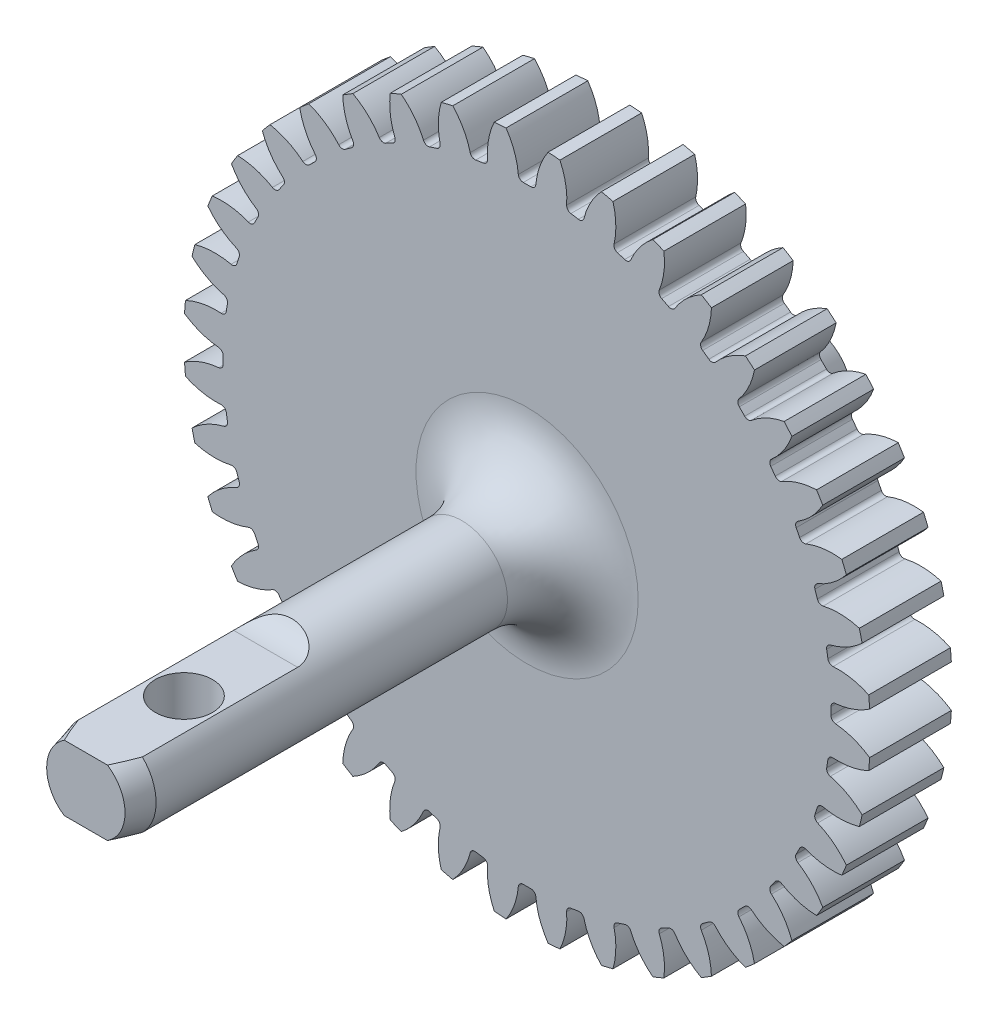
from build123d import *

# Parameters (mm, degrees)
SKETCH1_R                = 21
BOSS_EXTRUDE1_DEPTH      = 2.5
CUT_EXTRUDE1_DEPTH       = 31.116440693
FILLET1_R                = 0.3
CIRPATTERN1_COUNT        = 40
FILLET1_OF_CIRPATTERN1_R = 0.3
SKETCH4_R                = 2.8
BOSS_EXTRUDE2_DEPTH      = 27
BOSS_EXTRUDE3_START      = 12.43
SKETCH5_R                = 2.8
BOSS_EXTRUDE3_DEPTH      = 12.43
FILLET3_R                = 7.4
CHAMFER1_SIZE            = 1.5
CHAMFER1_SIZE2           = 0.401923789
FILLET4_R                = 4
CHAMFER2_SIZE            = 1.5
CHAMFER2_SIZE2           = 0.401923789
CUT_EXTRUDE2_START       = -13
CUT_EXTRUDE2_DEPTH       = 13
SKETCH7_R                = 1.75
CUT_EXTRUDE3_DEPTH       = 11
FILLET5_R                = 2


with BuildPart() as part:
    # Sketch1 → Boss-Extrude1 (new, symmetric)
    with BuildSketch(Plane.XY):
        Circle(SKETCH1_R)
    extrude(amount=BOSS_EXTRUDE1_DEPTH, both=True)

    # Sketch3 → Cut-Extrude1 (cut, symmetric)
    with BuildSketch(Plane.XY.offset(2.5)):
        with BuildLine():
            ThreePointArc((-2.139593078, 21.895710572), (-0.970695217, 20.420263648), (-0.519675362, 18.592738839))
            ThreePointArc((-0.519675362, 18.592738839), (0, 18.6), (0.519675362, 18.592738839))
            ThreePointArc((0.519675362, 18.592738839), (0.970695217, 20.420263648), (2.139593078, 21.895710572))
            ThreePointArc((2.139593078, 21.895710572), (0, 22), (-2.139593078, 21.895710572))
        make_face()
    cut_extrude1 = extrude(amount=CUT_EXTRUDE1_DEPTH, both=True, mode=Mode.SUBTRACT)

    # Fillet1
    fillet1_edges = [part.edges().sort_by_distance(p)[0] for p in [
        (-0.519675362, 18.592738839, 0),
        (0.519675362, 18.592738839, 0),
    ]]
    fillet(fillet1_edges, radius=FILLET1_R)

    # CirPattern1: Cut-Extrude1 ×40 about axis
    cirpattern1_axis = Axis((0, 0, 0), (0, 0, 1))
    for i in range(1, CIRPATTERN1_COUNT):
        add(cut_extrude1.rotate(cirpattern1_axis, i * 360 / CIRPATTERN1_COUNT), mode=Mode.SUBTRACT)

    # Fillet1 of CirPattern1
    fillet1_of_cirpattern1_edges = [part.edges().sort_by_distance(p)[0] for p in [
        (-3.42182245, 18.282536233, 0),
        (-2.395267858, 18.445126508, 0),
        (-6.239712913, 17.52215691, 0),
        (-5.251231633, 17.843333947, 0),
        (-8.903960935, 16.33032393, 0),
        (-7.977892658, 16.802179285, 0),
        (-11.348963889, 14.736384178, 0),
        (-10.508111489, 15.347299206, 0),
        (-13.514517686, 12.779585741, 0),
        (-12.779585741, 13.514517686, 0),
        (-15.347299206, 10.508111489, 0),
        (-14.736384178, 11.348963889, 0),
        (-16.802179285, 7.977892658, 0),
        (-16.33032393, 8.903960935, 0),
        (-17.843333947, 5.251231633, 0),
        (-17.52215691, 6.239712913, 0),
        (-18.445126508, 2.395267858, 0),
        (-18.282536233, 3.42182245, 0),
        (-18.592738839, -0.519675362, 0),
        (-18.592738839, 0.519675362, 0),
        (-18.282536233, -3.42182245, 0),
        (-18.445126508, -2.395267858, 0),
        (-17.52215691, -6.239712913, 0),
        (-17.843333947, -5.251231633, 0),
        (-16.33032393, -8.903960935, 0),
        (-16.802179285, -7.977892658, 0),
        (-14.736384178, -11.348963889, 0),
        (-15.347299206, -10.508111489, 0),
        (-12.779585741, -13.514517686, 0),
        (-13.514517686, -12.779585741, 0),
        (-10.508111489, -15.347299206, 0),
        (-11.348963889, -14.736384178, 0),
        (-7.977892658, -16.802179285, 0),
        (-8.903960935, -16.33032393, 0),
        (-5.251231633, -17.843333947, 0),
        (-6.239712913, -17.52215691, 0),
        (-2.395267858, -18.445126508, 0),
        (-3.42182245, -18.282536233, 0),
        (0.519675362, -18.592738839, 0),
        (-0.519675362, -18.592738839, 0),
        (3.42182245, -18.282536233, 0),
        (2.395267858, -18.445126508, 0),
        (6.239712913, -17.52215691, 0),
        (5.251231633, -17.843333947, 0),
        (8.903960935, -16.33032393, 0),
        (7.977892658, -16.802179285, 0),
        (11.348963889, -14.736384178, 0),
        (10.508111489, -15.347299206, 0),
        (13.514517686, -12.779585741, 0),
        (12.779585741, -13.514517686, 0),
        (15.347299206, -10.508111489, 0),
        (14.736384178, -11.348963889, 0),
        (16.802179285, -7.977892658, 0),
        (16.33032393, -8.903960935, 0),
        (17.843333947, -5.251231633, 0),
        (17.52215691, -6.239712913, 0),
        (18.445126508, -2.395267858, 0),
        (18.282536233, -3.42182245, 0),
        (18.592738839, 0.519675362, 0),
        (18.592738839, -0.519675362, 0),
        (18.282536233, 3.42182245, 0),
        (18.445126508, 2.395267858, 0),
        (17.52215691, 6.239712913, 0),
        (17.843333947, 5.251231633, 0),
        (16.33032393, 8.903960935, 0),
        (16.802179285, 7.977892658, 0),
        (14.736384178, 11.348963889, 0),
        (15.347299206, 10.508111489, 0),
        (12.779585741, 13.514517686, 0),
        (13.514517686, 12.779585741, 0),
        (10.508111489, 15.347299206, 0),
        (11.348963889, 14.736384178, 0),
        (7.977892658, 16.802179285, 0),
        (8.903960935, 16.33032393, 0),
        (5.251231633, 17.843333947, 0),
        (6.239712913, 17.52215691, 0),
        (2.395267858, 18.445126508, 0),
        (3.42182245, 18.282536233, 0),
    ]]
    fillet(fillet1_of_cirpattern1_edges, radius=FILLET1_OF_CIRPATTERN1_R)

    # Sketch4 → Boss-Extrude2 (add)
    with BuildSketch(Plane.XY.offset(2.5)):
        Circle(SKETCH4_R)
    extrude(amount=BOSS_EXTRUDE2_DEPTH)

    # Sketch5 → Boss-Extrude3 (add)
    with BuildSketch(Plane(origin=(0, 0, -2.5), x_dir=(-1, 0, 0), z_dir=(0, 0, -1)).offset(BOSS_EXTRUDE3_START)):
        with Locations(Location((0, 0, 0), (0, 0, 180))):
            Circle(SKETCH5_R)
    extrude(amount=-BOSS_EXTRUDE3_DEPTH)

    # Fillet3
    fillet3_edges = [part.edges().sort_by_distance(p)[0] for p in [
        (-2.8, 0, -2.5),
    ]]
    fillet(fillet3_edges, radius=FILLET3_R)

    # Chamfer1
    chamfer1_edges = [part.edges().sort_by_distance(p)[0] for p in [
        (-2.8, 0, -14.93),
    ]]
    chamfer1_side = [part.faces().sort_by_distance(p)[0] for p in [
        (-2.8, 0, -12.415),
    ]]
    chamfer(chamfer1_edges, length=CHAMFER1_SIZE, length2=CHAMFER1_SIZE2, reference=chamfer1_side[0])

    # Fillet4
    fillet4_edges = [part.edges().sort_by_distance(p)[0] for p in [
        (-2.8, 0, 2.5),
    ]]
    fillet(fillet4_edges, radius=FILLET4_R)

    # Chamfer2
    chamfer2_edges = [part.edges().sort_by_distance(p)[0] for p in [
        (-2.8, 0, 29.5),
    ]]
    chamfer2_side = [part.faces().sort_by_distance(p)[0] for p in [
        (-2.8, 0, 18),
    ]]
    chamfer(chamfer2_edges, length=CHAMFER2_SIZE, length2=CHAMFER2_SIZE2, reference=chamfer2_side[0])

    # Sketch6 → Cut-Extrude2 (cut)
    with BuildSketch(Plane.XY.offset(29.5).offset(CUT_EXTRUDE2_START)):
        with BuildLine():
            Line((-1.959591794, -2), (1.959591794, -2))
            ThreePointArc((1.959591794, -2), (0, -2.8), (-1.959591794, -2))
        make_face()
        with BuildLine():
            Line((-1.959591794, 2), (1.959591794, 2))
            ThreePointArc((1.959591794, 2), (0, 2.8), (-1.959591794, 2))
        make_face()
    extrude(amount=CUT_EXTRUDE2_DEPTH, mode=Mode.SUBTRACT)

    # Sketch7 → Cut-Extrude3 (cut)
    with BuildSketch(Plane(origin=(0, 2, 0), x_dir=(1, 0, 0), z_dir=(0, 1, 0))):
        with Locations(Location((0, -23.5, 0), (0, 0, 270))):
            Circle(SKETCH7_R)
    extrude(amount=-CUT_EXTRUDE3_DEPTH, mode=Mode.SUBTRACT)

    # Fillet5
    # the kernel refuses this fillet: 2 mm, written as the material it adds along each edge
    with BuildSketch(Plane(origin=(-6.959591794, -2, 16.5), x_dir=(0, 0, 1), z_dir=(1, 0, 0))) as fillet5_piece_1_section:
        with BuildLine():
            CenterArc((FILLET5_R, FILLET5_R), FILLET5_R, 180, 90)
            Line((0, FILLET5_R), (0, 0))
            Line((0, 0), (FILLET5_R, 0))
        make_face()
    fillet5_piece_1 = extrude(amount=13.919183588, mode=Mode.PRIVATE)
    fillet5_piece_1 = fillet5_piece_1 & Plane(origin=(0, 0, 17.097335046), x_dir=(1, 0, 0), z_dir=(0, 0, -1)) * Cylinder(2.8, 36, mode=Mode.PRIVATE)
    add(fillet5_piece_1)
    with BuildSketch(Plane(origin=(-6.959591794, 2, 16.5), x_dir=(0, 0, 1), z_dir=(1, 0, 0))) as fillet5_piece_2_section:
        with BuildLine():
            CenterArc((FILLET5_R, -FILLET5_R), FILLET5_R, 90, 90)
            Line((0, -FILLET5_R), (0, 0))
            Line((0, 0), (FILLET5_R, 0))
        make_face()
    fillet5_piece_2 = extrude(amount=13.919183588, mode=Mode.PRIVATE)
    fillet5_piece_2 = fillet5_piece_2 & Plane(origin=(0, 0, 17.097335046), x_dir=(1, 0, 0), z_dir=(0, 0, -1)) * Cylinder(2.8, 36, mode=Mode.PRIVATE)
    add(fillet5_piece_2)


solid = part.part
